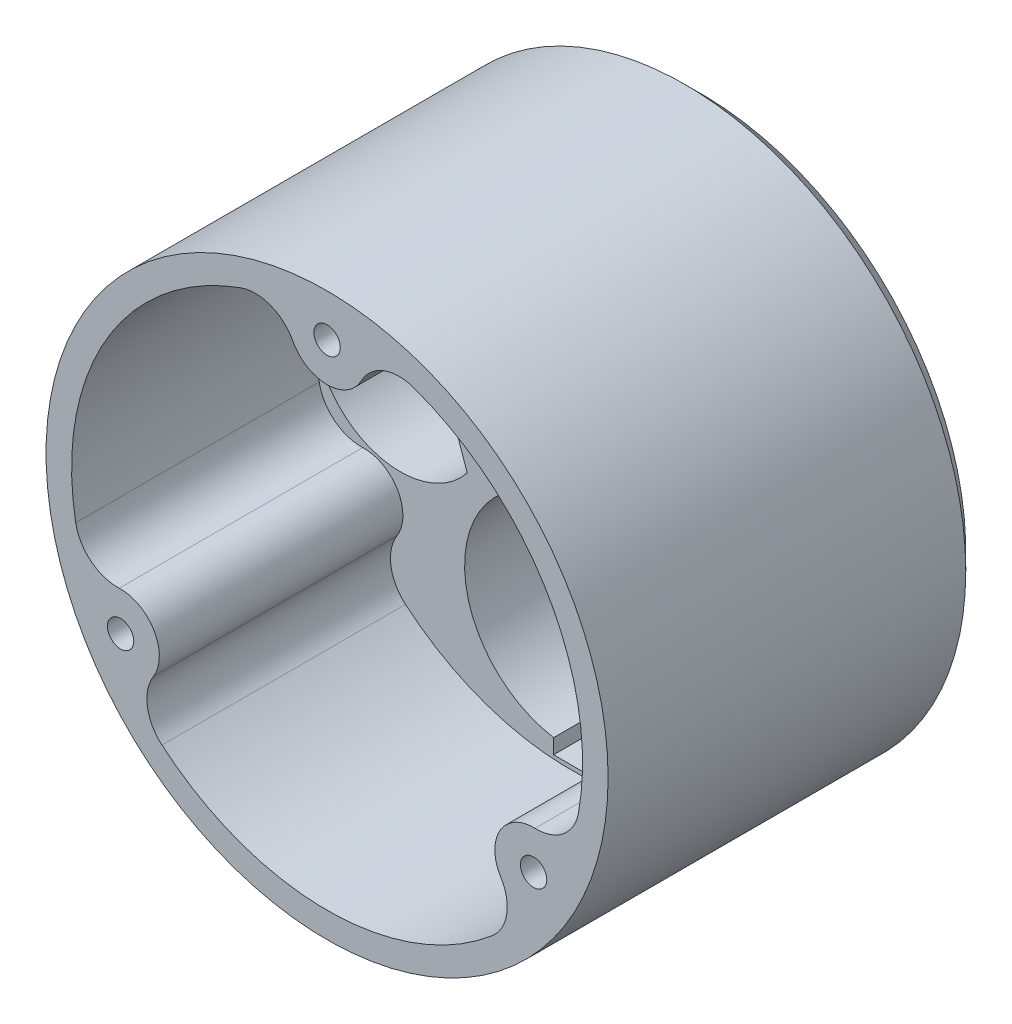
from build123d import *

# Parameters (mm, degrees)
SKETCH1_R                = 15.45
SKETCH1_R_2              = 12.45
SKETCH1_R_3              = 33
SKETCH1_R_4              = 30
SKETCH1_R_5              = 4.05
SKETCH1_R_6              = 1.05
BOSS_EXTRUDE2_DEPTH      = 12.4
BOSS_EXTRUDE3_START      = 3
SKETCH2_R                = 33
BOSS_EXTRUDE3_DEPTH      = 3
SKETCH3_R                = 33
SKETCH3_R_2              = 30
BOSS_EXTRUDE4_DEPTH      = 28.6
FILLET1_R                = 10
BOSS_EXTRUDE5_DEPTH      = 12.4
CHAMFER1_SIZE            = 4
FILLET2_R                = 5
BOSS_EXTRUDE6_DEPTH      = 28.6
BOSS_EXTRUDE6_DEPTH_BACK = 14.4
SKETCH5_R                = 4.55
SKETCH5_R_2              = 1.55
FILLET3_R                = 5
CHAMFER2_SIZE            = 2
SKETCH6_W                = 4
SKETCH6_H                = 2
CUT_EXTRUDE1_DEPTH       = 23.4


with BuildPart() as part:
    # Sketch1 → Boss-Extrude2 (new body)
    # profile 1 of 4: a face of its own
    with BuildSketch(Plane.XY):
        Circle(SKETCH1_R)
        with Locations(Location((0, 0, 0), (0, 0, 180))):
            Circle(SKETCH1_R_2, mode=Mode.SUBTRACT)
    # profile 2 of 4: a face of its own
    with BuildSketch(Plane.XY):
        with Locations(Location((0, 15.45, 0), (0, 0, 180))):
            Circle(SKETCH1_R_3)
        with Locations((0, 15.45)):
            Circle(SKETCH1_R_4, mode=Mode.SUBTRACT)
    # profile 3 of 4: a face of its own
    with BuildSketch(Plane.XY):
        with Locations(Location((11.5, 19.918584287, 0), (0, 0, 180))):
            Circle(SKETCH1_R_5)
        with Locations(Location((11.5, 19.918584287, 0), (0, 0, 180))):
            Circle(SKETCH1_R_6, mode=Mode.SUBTRACT)
    # profile 4 of 4: a face of its own
    with BuildSketch(Plane.XY):
        with Locations(Location((-11.5, 19.918584287, 0), (0, 0, 180))):
            Circle(SKETCH1_R_5)
        with Locations(Location((-11.5, 19.918584287, 0), (0, 0, 180))):
            Circle(SKETCH1_R_6, mode=Mode.SUBTRACT)
    extrude(amount=BOSS_EXTRUDE2_DEPTH)

    # Sketch2 → Boss-Extrude3 (add)
    with BuildSketch(Plane(origin=(0, 0, 0), x_dir=(-1, 0, 0), z_dir=(0, 0, -1)).offset(BOSS_EXTRUDE3_START)):
        with Locations(Location((0, 15.45, 0), (0, 0, 180))):
            Circle(SKETCH2_R)
    extrude(amount=-BOSS_EXTRUDE3_DEPTH)

    # Sketch3 → Boss-Extrude4 (add)
    with BuildSketch(Plane.XY.offset(12.4)):
        with Locations((0, 15.45)):
            Circle(SKETCH3_R)
        with Locations(Location((0, 15.45, 0), (0, 0, 256.137567884))):
            Circle(SKETCH3_R_2, mode=Mode.SUBTRACT)
    extrude(amount=BOSS_EXTRUDE4_DEPTH)

    # Fillet1
    # the kernel refuses this fillet: 10 mm, written as the material it adds along each edge
    with BuildSketch(Plane(origin=(-7.18774525, -13.676213592, 12.4), x_dir=(-0.20848530714015037, 0.9780254990063793, 0), z_dir=(0, 0, -1))) as fillet1_piece_1:
        with BuildLine():
            CenterArc((31.441766058, -6.395526036), FILLET1_R, 140.241533635, 142.62650255)
            ThreePointArc((33.668828933, -16.144381915), (14.016585538, -13.948724396), (0, 0))
            ThreePointArc((0, 0), (11.877146347, -5.568912274), (23.754292694, 0))
        make_face()
    extrude(amount=12.4)
    with BuildSketch(Plane(origin=(7.18774525, -13.676213592, 12.4), x_dir=(0.20848530714015037, 0.9780254990063793, 0), z_dir=(0, 0, -1))) as fillet1_piece_2:
        with BuildLine():
            CenterArc((31.441766058, 6.395526036), FILLET1_R, 77.131963815, 142.62650255)
            ThreePointArc((33.668828933, 16.144381915), (14.016585538, 13.948724396), (0, 0))
            ThreePointArc((0, 0), (11.877146347, 5.568912274), (23.754292694, 0))
        make_face()
    extrude(amount=12.4)

    # Sketch4 → Boss-Extrude5 (add)
    with BuildSketch(Plane.XY):
        Polygon((-15.355968184, 18.680032971), (-12.140166258, 9.556090373), (-4.457434094, 12.838952207), (4.080215127, 12.838952207), (12.140166258, 9.556090373), (15.355968184, 18.680032971), (9.70403689, 17.830268754), (8.160430255, 22.209822799), (0, 15.45), (-8.160430255, 22.209822799), (-10.090971595, 17.830268754), align=None)
    extrude(amount=BOSS_EXTRUDE5_DEPTH)

    # Chamfer1
    chamfer1_edges = [part.edges().sort_by_distance(p)[0] for p in [
        (0, 45.45, 0),
        (-23.339432443, 6.316081984, 0),
        (23.339432443, 6.316081984, 0),
    ]]
    chamfer(chamfer1_edges, length=CHAMFER1_SIZE)

    # Fillet2
    # the kernel refuses this fillet: 5 mm, written as the material it adds along each edge
    with BuildSketch(Plane(origin=(-11.5, 19.918584287, 0), x_dir=(0.4626548968458433, -0.8865384630260337, 0), z_dir=(0.8865384630260337, 0.4626548968458433, 0))) as fillet2_piece_1:
        with BuildLine():
            CenterArc((4.05 + FILLET2_R, -FILLET2_R), FILLET2_R, 90, 90)
            Line((4.05, -FILLET2_R), (4.05, 0))
            Line((4.05, 0), (4.05 + FILLET2_R, 0))
        make_face()
    revolve(axis=Axis((-11.5, 19.918584287, 0), (0, 0, -1)), revolution_arc=359.64)
    with BuildSketch(Plane(origin=(11.5, 19.918584287, 0), x_dir=(-0.4682160132284685, -0.8836140361925214, 0), z_dir=(0.8836140361925214, -0.4682160132284685, 0))) as fillet2_piece_2:
        with BuildLine():
            CenterArc((4.05 + FILLET2_R, -FILLET2_R), FILLET2_R, 90, 90)
            Line((4.05, -FILLET2_R), (4.05, 0))
            Line((4.05, 0), (4.05 + FILLET2_R, 0))
        make_face()
    revolve(axis=Axis((11.5, 19.918584287, 0), (0, 0, -1)), revolution_arc=359.64)

    # Sketch5 → Boss-Extrude6 (add, two sides: drawn at the far end of the back side and taken through both)
    # profile 1 of 3: a face of its own
    with BuildSketch(Plane.XY.offset(12.4).offset(-BOSS_EXTRUDE6_DEPTH_BACK)):
        with Locations((0, 43.45)):
            Circle(SKETCH5_R)
        with Locations((0, 43.45)):
            Circle(SKETCH5_R_2, mode=Mode.SUBTRACT)
    # profile 2 of 3: a face of its own
    with BuildSketch(Plane.XY.offset(12.4).offset(-BOSS_EXTRUDE6_DEPTH_BACK)):
        with Locations((24.248711306, 1.45)):
            Circle(SKETCH5_R)
        with Locations((24.248711306, 1.45)):
            Circle(SKETCH5_R_2, mode=Mode.SUBTRACT)
    # profile 3 of 3: a face of its own
    with BuildSketch(Plane.XY.offset(12.4).offset(-BOSS_EXTRUDE6_DEPTH_BACK)):
        with Locations((-24.248711306, 1.45)):
            Circle(SKETCH5_R)
        with Locations((-24.248711306, 1.45)):
            Circle(SKETCH5_R_2, mode=Mode.SUBTRACT)
    extrude(amount=BOSS_EXTRUDE6_DEPTH + BOSS_EXTRUDE6_DEPTH_BACK)

    # Fillet3
    fillet3_edges = [part.edges().sort_by_distance(p)[0] for p in [
        (23.612570286, -3.055310711, 26.7),
        (27.832354323, 4.25356964, 26.7),
        (-27.832354323, 4.25356964, 26.7),
        (-23.612570286, -3.055310711, 26.7),
        (4.219784038, 45.151741071, 22.5),
        (-4.219784038, 45.151741071, 22.5),
    ]]
    fillet(fillet3_edges, radius=FILLET3_R)

    # Chamfer2
    chamfer2_edges = [part.edges().sort_by_distance(p)[0] for p in [
        (-33, 15.45, -3),
    ]]
    chamfer(chamfer2_edges, length=CHAMFER2_SIZE)

    # Sketch6 → Cut-Extrude1 (cut)
    with BuildSketch(Plane.XY.offset(12.4)):
        with Locations((0, -13.034949107)):
            Rectangle(SKETCH6_W, SKETCH6_H)
    extrude(amount=-CUT_EXTRUDE1_DEPTH, mode=Mode.SUBTRACT)


solid = part.part
